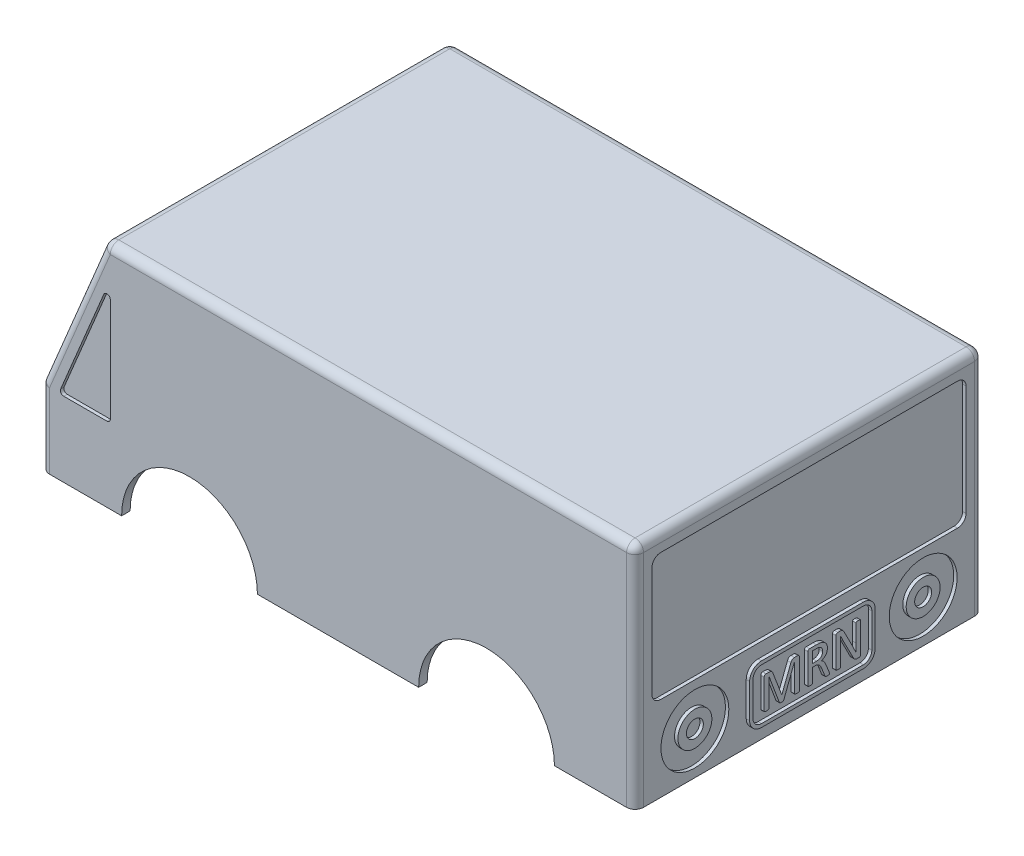
from build123d import *

# Parameters (mm, degrees)
BOSS_EXTRUDE1_DEPTH = 205
FILLET1_R           = 5
SHELL1_START        = 5
SHELL1_DEPTH        = 195
SKETCH4_W           = 183
SKETCH4_H           = 81.166666667
CUT_EXTRUDE1_DEPTH  = 2
FILLET2_R           = 5
CUT_EXTRUDE4_REACH  = 429.493
SKETCH8_R           = 40
CUT_EXTRUDE5_DEPTH  = 205
CUT_EXTRUDE12_DEPTH = 2
CUT_EXTRUDE13_DEPTH = 2
FILLET3_R           = 2
SKETCH13_W          = 185
SKETCH13_H          = 75
CUT_EXTRUDE14_DEPTH = 2
FILLET4_R           = 5
BOSS_EXTRUDE5_DEPTH = 2
BOSS_EXTRUDE6_DEPTH = 2
BOSS_EXTRUDE7_DEPTH = 2
BOSS_EXTRUDE8_DEPTH = 2
CUT_EXTRUDE16_DEPTH = 2
CUT_EXTRUDE17_DEPTH = 2


# Read off the part's stored shape, not the designer's step: Shell1
with BuildPart() as part:
    # Sketch1 → Boss-Extrude1 (new body)
    with BuildSketch(Plane.XY):
        Polygon((0, 0), (350, 0), (350, 135), (37.5, 135), (0, 45), align=None)
    extrude(amount=BOSS_EXTRUDE1_DEPTH)

    # Fillet1
    fillet1_edges = [part.edges().sort_by_distance(p)[0] for p in [
        (350, 67.5, 205),
        (193.75, 135, 205),
        (18.75, 90, 205),
        (0, 22.5, 205),
        (18.75, 90, 0),
        (193.75, 135, 0),
        (350, 67.5, 0),
        (0, 22.5, 0),
        (0, 45, 102.5),
        (37.5, 135, 102.5),
        (350, 135, 102.5),
    ]]
    fillet(fillet1_edges, radius=FILLET1_R)

    # Shell1 outline → Shell1 (cut)
    with BuildSketch(Plane.XY.offset(SHELL1_START)):
        Polygon((5, 44), (5, 0), (345, 0), (345, 130), (40.833333333, 130), align=None)
    extrude(amount=SHELL1_DEPTH, mode=Mode.SUBTRACT)

    # Sketch4 → Cut-Extrude1 (cut)
    with BuildSketch(Plane(origin=(-15.976331361, 6.656804734, 0), x_dir=(0, 0, 1), z_dir=(-0.9230769230769232, 0.38461538461538447, 0))):
        with Locations((102.5, 89.121794872)):
            Rectangle(SKETCH4_W, SKETCH4_H)
    extrude(amount=-CUT_EXTRUDE1_DEPTH, mode=Mode.SUBTRACT)

    # Fillet2
    fillet2_edges = [part.edges().sort_by_distance(p)[0] for p in [
        (3.615384615, 51.076923077, 194),
        (3.615384615, 51.076923077, 11),
        (34.833333333, 126, 11),
        (34.833333333, 126, 194),
    ]]
    fillet(fillet2_edges, radius=FILLET2_R)

    # Cut-Extrude4: up to this face of the body (flat: up to its plane)
    cut_extrude4_end = Plane(part.part.faces().sort_by_distance((180.70890825, 63.687653429, 0))[0])
    # Sketch8 → Cut-Extrude4 (cut, up to the picked face)
    with BuildSketch(Plane.XY.offset(205), mode=Mode.PRIVATE) as cut_extrude4_sk1:
        with Locations((87.5, 0)):
            Circle(SKETCH8_R)
    cut_extrude4_tool1 = split(extrude(cut_extrude4_sk1.sketch, amount=-CUT_EXTRUDE4_REACH, mode=Mode.PRIVATE), bisect_by=cut_extrude4_end, keep=Keep.BOTH, mode=Mode.PRIVATE)
    add(cut_extrude4_tool1.solids().sort_by(Axis((87.5, 0, 205), (0, 0, -1)))[0], mode=Mode.SUBTRACT)

    # Sketch9 → Cut-Extrude5 (cut)
    with BuildSketch(Plane.XY.offset(205)):
        with BuildLine():
            ThreePointArc((222.5, 0), (262.5, -40), (302.5, 0))
            Line((302.5, 0), (262.5, 0))
            Line((262.5, 0), (222.5, 0))
        make_face()
        with BuildLine():
            Line((262.5, 0), (302.5, 0))
            ThreePointArc((302.5, 0), (262.5, 40), (222.5, 0))
            Line((222.5, 0), (262.5, 0))
        make_face()
    extrude(amount=-CUT_EXTRUDE5_DEPTH, mode=Mode.SUBTRACT)

    # Sketch10 → Cut-Extrude12 (cut)
    with BuildSketch(Plane.XY.offset(205)):
        Polygon((40.833333333, 44), (40.833333333, 117), (10.416666667, 44), align=None)
    extrude(amount=-CUT_EXTRUDE12_DEPTH, mode=Mode.SUBTRACT)

    # Sketch12 → Cut-Extrude13 (cut)
    with BuildSketch(Plane(origin=(0, 0, 0), x_dir=(-1, 0, 0), z_dir=(0, 0, -1))):
        Polygon((-10.416666667, 44), (-40.833333333, 117), (-40.833333333, 44), align=None)
    extrude(amount=-CUT_EXTRUDE13_DEPTH, mode=Mode.SUBTRACT)

    # Fillet3
    fillet3_edges = [part.edges().sort_by_distance(p)[0] for p in [
        (40.833333333, 44, 204),
        (10.416666667, 44, 204),
        (40.833333333, 117, 204),
        (40.833333333, 44, 1),
        (40.833333333, 117, 1),
        (10.416666667, 44, 1),
    ]]
    fillet(fillet3_edges, radius=FILLET3_R)

    # Sketch13 → Cut-Extrude14 (cut)
    with BuildSketch(Plane(origin=(350, 0, 0), x_dir=(0, 0, -1), z_dir=(1, 0, 0))):
        with Locations((-102.5, 87.5)):
            Rectangle(SKETCH13_W, SKETCH13_H)
    extrude(amount=-CUT_EXTRUDE14_DEPTH, mode=Mode.SUBTRACT)

    # Fillet4
    fillet4_edges = [part.edges().sort_by_distance(p)[0] for p in [
        (349, 125, 10),
        (349, 50, 10),
        (349, 50, 195),
        (349, 125, 195),
    ]]
    fillet(fillet4_edges, radius=FILLET4_R)

    # Sketch14 → Boss-Extrude5 (add)
    with BuildSketch(Plane.ZY):
        with BuildLine():
            ThreePointArc((132.5, 39), (137.449747468, 36.949747468), (139.5, 32))
            Line((139.5, 32), (139.5, 12))
            ThreePointArc((139.5, 12), (137.449747468, 7.050252532), (132.5, 5))
            Line((132.5, 5), (72.5, 5))
            ThreePointArc((72.5, 5), (67.550252532, 7.050252532), (65.5, 12))
            Line((65.5, 12), (65.5, 32))
            ThreePointArc((65.5, 32), (67.550252532, 36.949747468), (72.5, 39))
            Line((72.5, 39), (132.5, 39))
        make_face()
        with BuildLine():
            ThreePointArc((72.5, 37), (68.964466094, 35.535533906), (67.5, 32))
            Line((67.5, 32), (67.5, 12))
            ThreePointArc((67.5, 12), (68.964466094, 8.464466094), (72.5, 7))
            Line((72.5, 7), (132.5, 7))
            ThreePointArc((132.5, 7), (136.035533906, 8.464466094), (137.5, 12))
            Line((137.5, 12), (137.5, 32))
            ThreePointArc((137.5, 32), (136.035533906, 35.535533906), (132.5, 37))
            Line((132.5, 37), (72.5, 37))
        make_face(mode=Mode.SUBTRACT)
    extrude(amount=BOSS_EXTRUDE5_DEPTH)

    # Sketch18 → Boss-Extrude6 (add)
    # profile 1 of 3: a face of its own
    with BuildSketch(Plane.ZY):
        with BuildLine():
            add(Edge.make_bspline(
                [(94.795955882, 12.468370864), (94.792679632, 12.431253299), (94.786160524, 12.357396483), (94.728957363, 12.254767665), (94.628339062, 12.172260128), (94.482327548, 12.113199979), (94.288785411, 12.075809298), (94.047953126, 12.026816611), (93.739940864, 12.003970812), (93.51341254, 12.001426073), (93.386465993, 12)],
                knots=[0, 0, 0, 0, 0.549940415, 1.094275647, 1.695058239, 2.453752044, 3.41269449, 4.626954335, 6.109744105, 8, 8, 8, 8], degree=3))
            add(Edge.make_bspline(
                [(93.386465993, 12), (93.266828939, 12.001700844), (93.044718685, 12.004858519), (92.739508266, 12.026485618), (92.494502974, 12.075744258), (92.300094584, 12.11198277), (92.15733555, 12.173745719), (92.056160182, 12.25348747), (92.0053255, 12.358680519), (91.998133337, 12.431456894), (91.994485294, 12.468370864)],
                knots=[0, 0, 0, 0, 1.798275377, 3.338559297, 4.58570577, 5.553580443, 6.299307474, 6.905686155, 7.444937074, 8, 8, 8, 8], degree=3))
            Line((91.994485294, 12.468370864), (91.994485294, 28.983915441))
            Line((91.994485294, 28.983915441), (91.96384421, 28.983915441))
            Line((91.96384421, 28.983915441), (85.581744026, 12.393956801))
            add(Edge.make_bspline(
                [(85.581744026, 12.393956801), (85.565528215, 12.362455949), (85.532219438, 12.297750281), (85.455337152, 12.214457182), (85.352241232, 12.138036694), (85.212857313, 12.08644423), (85.041800249, 12.04844666), (84.841447814, 12.017916341), (84.604440608, 12.000937738), (84.434921167, 12.000329776), (84.34296875, 12)],
                knots=[0, 0, 0, 0, 0.617868315, 1.269158706, 1.964077171, 2.846421734, 3.844013633, 5.032644331, 6.390417486, 8, 8, 8, 8], degree=3))
            add(Edge.make_bspline(
                [(84.34296875, 12), (84.246671794, 12.002370625), (84.068497745, 12.006756889), (83.820742866, 12.020673171), (83.614176662, 12.055546439), (83.446004201, 12.101676978), (83.314760298, 12.161319959), (83.209338822, 12.222905064), (83.141711577, 12.306556788), (83.11336895, 12.365683708), (83.099816176, 12.393956801)],
                knots=[0, 0, 0, 0, 1.684713544, 3.117151853, 4.33356902, 5.342914851, 6.153770431, 6.85436779, 7.4521858, 8, 8, 8, 8], degree=3))
            Line((83.099816176, 12.393956801), (76.884053309, 28.983915441))
            Line((76.884053309, 28.983915441), (76.866544118, 28.983915441))
            Line((76.866544118, 28.983915441), (76.866544118, 12.468370864))
            add(Edge.make_bspline(
                [(76.866544118, 12.468370864), (76.863267741, 12.431253841), (76.856748381, 12.357398106), (76.799547159, 12.254760974), (76.698920031, 12.172291292), (76.551622042, 12.112491447), (76.354904653, 12.076120123), (76.108346044, 12.026452909), (75.795903251, 12.004340883), (75.56648331, 12.001546265), (75.439545037, 12)],
                knots=[0, 0, 0, 0, 0.544103173, 1.082660658, 1.677066352, 2.427707141, 3.397415481, 4.619936966, 6.129807882, 8, 8, 8, 8], degree=3))
            add(Edge.make_bspline(
                [(75.439545037, 12), (75.316996128, 12.001627042), (75.093430802, 12.004595246), (74.788122495, 12.026238337), (74.546284445, 12.076436555), (74.354264588, 12.111097396), (74.214384903, 12.173687478), (74.117304372, 12.25392861), (74.071512151, 12.359406944), (74.067248917, 12.43155572), (74.065073529, 12.468370864)],
                knots=[0, 0, 0, 0, 1.8533371, 3.381033053, 4.614072809, 5.587846392, 6.318072483, 6.911573342, 7.444611737, 8, 8, 8, 8], degree=3))
            Line((74.065073529, 12.468370864), (74.065073529, 29.907525276))
            add(Edge.make_bspline(
                [(74.065073529, 29.907525276), (74.068464398, 30.00290607), (74.074820495, 30.18169495), (74.14216518, 30.427042755), (74.245900674, 30.635745412), (74.406753799, 30.787968069), (74.584936811, 30.904515318), (74.776813189, 30.990656634), (74.979055703, 31.038549688), (75.116854843, 31.046186653), (75.185661765, 31.05)],
                knots=[0, 0, 0, 0, 1.261982118, 2.365553467, 3.35280749, 4.310975745, 5.26129003, 6.171318277, 7.086888644, 8, 8, 8, 8], degree=3))
            Line((75.185661765, 31.05), (76.831525735, 31.05))
            add(Edge.make_bspline(
                [(76.831525735, 31.05), (76.990864552, 31.046562562), (77.287765331, 31.04015748), (77.705882484, 30.973854401), (78.071068207, 30.864025303), (78.383630537, 30.692207334), (78.654301837, 30.477740272), (78.86550976, 30.197446766), (79.046956171, 29.874358003), (79.138568081, 29.63464288), (79.186511949, 29.509191176)],
                knots=[0, 0, 0, 0, 1.24751318, 2.324528587, 3.308036964, 4.218670816, 5.104345063, 5.991788597, 6.949029422, 8, 8, 8, 8], degree=3))
            Line((79.186511949, 29.509191176), (84.430514706, 15.781985294))
            Line((84.430514706, 15.781985294), (84.504928768, 15.781985294))
            Line((84.504928768, 15.781985294), (89.836477482, 29.465418199))
            add(Edge.make_bspline(
                [(89.836477482, 29.465418199), (89.895058768, 29.602396137), (90.005335777, 29.860251819), (90.202074156, 30.205955626), (90.417511207, 30.489017882), (90.657779476, 30.70857491), (90.923202498, 30.872468131), (91.220505, 30.976640955), (91.552695597, 31.038612326), (91.786989814, 31.046052119), (91.911316636, 31.05)],
                knots=[0, 0, 0, 0, 1.266394147, 2.383938095, 3.374429421, 4.279357972, 5.137103734, 6.00865411, 6.943304242, 8, 8, 8, 8], degree=3))
            Line((91.911316636, 31.05), (93.640349265, 31.05))
            add(Edge.make_bspline(
                [(93.640349265, 31.05), (93.717937079, 31.046380189), (93.87025882, 31.039273714), (94.089547367, 30.991213142), (94.290771847, 30.910535005), (94.459813169, 30.782392888), (94.605341854, 30.623251183), (94.706837763, 30.419790283), (94.790405639, 30.180796586), (94.794011008, 30.003282924), (94.795955882, 29.907525276)],
                knots=[0, 0, 0, 0, 1.011400516, 1.985599013, 2.915098522, 3.813295393, 4.72984914, 5.700323623, 6.759466748, 8, 8, 8, 8], degree=3))
            Line((94.795955882, 29.907525276), (94.795955882, 12.468370864))
        make_face()
    # profile 2 of 3: a face of its own
    with BuildSketch(Plane.ZY):
        with BuildLine():
            add(Edge.make_bspline(
                [(112.615935202, 12.472748162), (112.614921222, 12.436081799), (112.612960798, 12.365191277), (112.578066836, 12.262261655), (112.496681163, 12.175410478), (112.368136134, 12.105424909), (112.182495814, 12.065176696), (111.942130398, 12.022498488), (111.626819842, 12.00530514), (111.391721486, 12.001914519), (111.258972886, 12)],
                knots=[0, 0, 0, 0, 0.552394781, 1.067996698, 1.59843911, 2.308737636, 3.243716164, 4.449494886, 5.995202554, 8, 8, 8, 8], degree=3))
            add(Edge.make_bspline(
                [(111.258972886, 12), (111.142226092, 12.001819225), (110.931826532, 12.005097808), (110.64755915, 12.024011362), (110.422638986, 12.062374203), (110.244797581, 12.117421057), (110.105585367, 12.198642471), (109.998982997, 12.309047771), (109.926479141, 12.452840499), (109.88775248, 12.556990015), (109.866992188, 12.612821691)],
                knots=[0, 0, 0, 0, 1.682217191, 3.031670033, 4.099618773, 4.963789911, 5.699229685, 6.398004984, 7.141214756, 8, 8, 8, 8], degree=3))
            Line((109.866992188, 12.612821691), (108.111695772, 17.152079504))
            add(Edge.make_bspline(
                [(108.111695772, 17.152079504), (108.010244526, 17.401071199), (107.814446145, 17.881618975), (107.496398293, 18.561796031), (107.15977639, 19.177779872), (106.810777684, 19.614855959), (106.505112522, 19.918351462), (106.2557839, 20.115682367), (105.983985393, 20.282576903), (105.695673794, 20.429061519), (105.379897574, 20.543711059), (105.036675853, 20.627092507), (104.662224645, 20.674154267), (104.402795936, 20.681008675), (104.268428309, 20.684558824)],
                knots=[0, 0, 0, 0, 1.715323276, 3.310531238, 4.791054184, 6.182626586, 6.860777511, 7.536944129, 8.206086956, 8.893127879, 9.597119937, 10.344592274, 11.14260373, 12, 12, 12, 12], degree=3))
            Line((104.268428309, 20.684558824), (102.640073529, 20.684558824))
            Line((102.640073529, 20.684558824), (102.640073529, 12.47712546))
            add(Edge.make_bspline(
                [(102.640073529, 12.47712546), (102.636882748, 12.439946191), (102.630362338, 12.363969798), (102.569493732, 12.260868876), (102.46930591, 12.177443268), (102.326078703, 12.118259482), (102.136751394, 12.073395252), (101.894834059, 12.027286447), (101.588476111, 12.004128585), (101.363383415, 12.001466845), (101.239338235, 12)],
                knots=[0, 0, 0, 0, 0.551870684, 1.127756021, 1.730647335, 2.472085589, 3.418462175, 4.636984023, 6.146692761, 8, 8, 8, 8], degree=3))
            add(Edge.make_bspline(
                [(101.239338235, 12), (101.115332329, 12.001655464), (100.888857816, 12.004678871), (100.58061269, 12.025974866), (100.337242124, 12.076212554), (100.144205302, 12.111945766), (100.001454509, 12.173752726), (99.90027755, 12.253485979), (99.849443216, 12.358680886), (99.842251007, 12.431457018), (99.838602941, 12.468370864)],
                knots=[0, 0, 0, 0, 1.853790896, 3.385616091, 4.604455936, 5.567015365, 6.308647111, 6.911695762, 7.447985294, 8, 8, 8, 8], degree=3))
            Line((99.838602941, 12.468370864), (99.838602941, 30.025712316))
            add(Edge.make_bspline(
                [(99.838602941, 30.025712316), (99.841091832, 30.113642543), (99.845759091, 30.278532559), (99.901759248, 30.503805607), (99.99460977, 30.69068593), (100.172005292, 30.866070041), (100.434267163, 31.013824127), (100.664034711, 31.038194077), (100.775344669, 31.05)],
                knots=[0, 0, 0, 0, 1.007241378, 1.88881631, 2.645546133, 3.368137109, 4.725004673, 6, 6, 6, 6], degree=3))
            Line((100.775344669, 31.05), (104.793704044, 31.05))
            add(Edge.make_bspline(
                [(104.793704044, 31.05), (105.011193811, 31.049627249), (105.40703927, 31.048948818), (105.953968898, 31.0129842), (106.418122901, 30.979214928), (106.703718237, 30.949943242), (106.837902114, 30.936190257)],
                knots=[0, 0, 0, 0, 1.27372654, 2.318264775, 3.209854915, 4, 4, 4, 4], degree=3))
            add(Edge.make_bspline(
                [(106.837902114, 30.936190257), (107.014723605, 30.901170062), (107.361630345, 30.832463811), (107.865113559, 30.707196449), (108.330886231, 30.533837225), (108.771130672, 30.351593127), (109.17302259, 30.128037505), (109.549344961, 29.891784432), (109.882519748, 29.615152947), (110.187573084, 29.318999521), (110.451215681, 28.991885204), (110.696028233, 28.651724254), (110.881948712, 28.275356315), (111.049471667, 27.885988447), (111.168273578, 27.470366556), (111.263038641, 27.036733241), (111.314491379, 26.580559712), (111.321216375, 26.270104568), (111.324632353, 26.112408088)],
                knots=[0, 0, 0, 0, 1.191122015, 2.336866698, 3.42242524, 4.471809322, 5.481243804, 6.457256698, 7.402799425, 8.336721758, 9.26124262, 10.175808252, 11.098517904, 12.027701383, 12.97324411, 13.948876047, 14.958126376, 16, 16, 16, 16], degree=3))
            add(Edge.make_bspline(
                [(111.324632353, 26.112408088), (111.320641055, 25.959117297), (111.312870126, 25.660665026), (111.270664984, 25.224013888), (111.192038791, 24.812471872), (111.080777684, 24.425414781), (110.947800244, 24.060188049), (110.777525894, 23.720983495), (110.586171602, 23.400568117), (110.292535395, 23.002227711), (109.857376832, 22.55234643), (109.246451387, 22.090011591), (108.548641757, 21.705108777), (108.045534992, 21.504972502), (107.787775735, 21.402435662)],
                knots=[0, 0, 0, 0, 0.870093262, 1.69404378, 2.48656215, 3.244089618, 3.9777523, 4.688775412, 5.394571765, 6.09348547, 7.493200162, 8.929089906, 10.426664953, 12, 12, 12, 12], degree=3))
            add(Edge.make_bspline(
                [(107.787775735, 21.402435662), (107.941013732, 21.330143932), (108.244811087, 21.186824151), (108.650546158, 20.881014249), (109.028879315, 20.527879344), (109.372817496, 20.106246309), (109.700765183, 19.625821167), (109.997111025, 19.071773234), (110.299790461, 18.456097071), (110.48105639, 18.014164931), (110.57611443, 17.782410386)],
                knots=[0, 0, 0, 0, 0.864679079, 1.714243352, 2.585566623, 3.507869762, 4.491310941, 5.557114259, 6.718921253, 8, 8, 8, 8], degree=3))
            Line((110.57611443, 17.782410386), (112.292015165, 13.558318015))
            add(Edge.make_bspline(
                [(112.292015165, 13.558318015), (112.322282193, 13.476476927), (112.378492388, 13.324486336), (112.460128233, 13.119814716), (112.510790816, 12.949781946), (112.561598312, 12.789228602), (112.606277779, 12.635740741), (112.613068413, 12.521132228), (112.615935202, 12.472748162)],
                knots=[0, 0, 0, 0, 1.38137286, 2.56540674, 3.485806926, 4.187128033, 5.23466316, 6, 6, 6, 6], degree=3))
        make_face()
        with BuildLine():
            add(Edge.make_bspline(
                [(108.523161765, 25.880411305), (108.5168383, 26.061597434), (108.50468072, 26.409948322), (108.424044363, 26.913753154), (108.272681699, 27.368956426), (108.073071701, 27.786691554), (107.796249569, 28.152641423), (107.441120025, 28.464899754), (107.006946537, 28.720730151), (106.679801982, 28.836263285), (106.509604779, 28.896369485)],
                knots=[0, 0, 0, 0, 1.106837018, 2.128019726, 3.103131596, 4.027783155, 4.943935065, 5.884596147, 6.899459546, 8, 8, 8, 8], degree=3))
            add(Edge.make_bspline(
                [(106.509604779, 28.896369485), (106.389108525, 28.929797184), (106.136450268, 28.999888857), (105.798576372, 29.043095415), (105.497030998, 29.062684931), (105.233250471, 29.084784386), (104.935189046, 29.083564494), (104.725109187, 29.087103041), (104.614234835, 29.088970588)],
                knots=[0, 0, 0, 0, 1.17598894, 2.465830294, 3.195893525, 4.021865782, 4.955995349, 6, 6, 6, 6], degree=3))
            Line((104.614234835, 29.088970588), (102.640073529, 29.088970588))
            Line((102.640073529, 29.088970588), (102.640073529, 22.645588235))
            Line((102.640073529, 22.645588235), (104.929400276, 22.645588235))
            add(Edge.make_bspline(
                [(104.929400276, 22.645588235), (105.078394146, 22.647099193), (105.367023587, 22.650026205), (105.782380742, 22.701006061), (106.167971071, 22.773876337), (106.523685153, 22.877618795), (106.847625525, 23.014996441), (107.145218156, 23.172486775), (107.41249461, 23.357870485), (107.654711261, 23.562993931), (107.867012924, 23.791972756), (108.045339533, 24.044072055), (108.201790075, 24.310069689), (108.35804534, 24.698243661), (108.495309717, 25.222178195), (108.513734517, 25.657615235), (108.523161765, 25.880411305)],
                knots=[0, 0, 0, 0, 1.139982929, 2.208363576, 3.198662771, 4.142437321, 5.038734787, 5.888427894, 6.715795914, 7.524011596, 8.31458568, 9.098978977, 9.884644091, 10.670944343, 12.296652677, 14, 14, 14, 14], degree=3))
        make_face(mode=Mode.SUBTRACT)
    # profile 3 of 3: a face of its own
    with BuildSketch(Plane.ZY):
        with BuildLine():
            add(Edge.make_bspline(
                [(130.934926471, 13.085569853), (130.930845084, 12.994358686), (130.923158162, 12.822570706), (130.840626645, 12.587071553), (130.716007103, 12.395881477), (130.558847234, 12.244071993), (130.375649366, 12.127594716), (130.172148016, 12.052489481), (129.96081479, 12.006967224), (129.818934543, 12.002307424), (129.748678768, 12)],
                knots=[0, 0, 0, 0, 1.205332051, 2.270133854, 3.263058457, 4.207272684, 5.146716114, 6.120602819, 7.069366549, 8, 8, 8, 8], degree=3))
            Line((129.748678768, 12), (128.855710018, 12))
            add(Edge.make_bspline(
                [(128.855710018, 12), (128.722775064, 12.004324328), (128.472813404, 12.012455496), (128.11580925, 12.069459095), (127.794936218, 12.194353939), (127.494696692, 12.38393148), (127.208029359, 12.651497545), (126.920693012, 12.994621804), (126.636055648, 13.428603473), (126.465432268, 13.757889902), (126.373782169, 13.934765625)],
                knots=[0, 0, 0, 0, 0.949232932, 1.784871716, 2.566305995, 3.389914927, 4.304220435, 5.353751779, 6.578571646, 8, 8, 8, 8], degree=3))
            Line((126.373782169, 13.934765625), (120.858386949, 24.72042739))
            add(Edge.make_bspline(
                [(120.858386949, 24.72042739), (120.713733459, 25.006303481), (120.419123588, 25.588535676), (119.978599799, 26.46866675), (119.564708147, 27.362718172), (119.299344231, 27.959306267), (119.16875, 28.25290671)],
                knots=[0, 0, 0, 0, 0.981689664, 1.999367364, 3.015423486, 4, 4, 4, 4], degree=3))
            Line((119.16875, 28.25290671), (119.138108915, 28.25290671))
            add(Edge.make_bspline(
                [(119.138108915, 28.25290671), (119.146381256, 27.898361626), (119.163128673, 27.180582426), (119.17027125, 26.097824705), (119.168370835, 25.00641187), (119.168623781, 24.278320654), (119.16875, 23.915004596)],
                knots=[0, 0, 0, 0, 0.98097619, 1.98599371, 2.995014897, 4, 4, 4, 4], degree=3))
            Line((119.16875, 23.915004596), (119.16875, 12.468370864))
            add(Edge.make_bspline(
                [(119.16875, 12.468370864), (119.165114163, 12.434219116), (119.157575438, 12.363407194), (119.100639347, 12.263278492), (119.002034319, 12.176603414), (118.856130094, 12.112020852), (118.661421854, 12.076307611), (118.419382954, 12.026286613), (118.111231107, 12.004367641), (117.884733903, 12.001557016), (117.75926011, 12)],
                knots=[0, 0, 0, 0, 0.508335614, 1.054008165, 1.670659208, 2.440203295, 3.401501664, 4.618744696, 6.126869023, 8, 8, 8, 8], degree=3))
            add(Edge.make_bspline(
                [(117.75926011, 12), (117.633800007, 12.001569283), (117.407327514, 12.004402051), (117.099027278, 12.026188054), (116.858785971, 12.076285306), (116.667023611, 12.110363374), (116.528488043, 12.179395808), (116.42995742, 12.261872882), (116.379396872, 12.364653792), (116.371247654, 12.434405456), (116.367279412, 12.468370864)],
                knots=[0, 0, 0, 0, 1.889779863, 3.4113088, 4.639371011, 5.587829463, 6.32466679, 6.946798791, 7.487146164, 8, 8, 8, 8], degree=3))
            Line((116.367279412, 12.468370864), (116.367279412, 29.964430147))
            add(Edge.make_bspline(
                [(116.367279412, 29.964430147), (116.370353958, 30.055533735), (116.376165014, 30.227724345), (116.44880855, 30.463014002), (116.557628, 30.663129153), (116.722782657, 30.80628665), (116.90618912, 30.91307267), (117.098709797, 30.994091802), (117.30206765, 31.038317756), (117.43951983, 31.046049361), (117.509754136, 31.05)],
                knots=[0, 0, 0, 0, 1.223169262, 2.311854749, 3.289963268, 4.250317348, 5.211476418, 6.146325302, 7.052822907, 8, 8, 8, 8], degree=3))
            Line((117.509754136, 31.05), (118.844829963, 31.05))
            add(Edge.make_bspline(
                [(118.844829963, 31.05), (118.989562041, 31.047910389), (119.254128913, 31.044090629), (119.620539873, 30.986165073), (119.935983464, 30.891769644), (120.210748448, 30.734466326), (120.467451165, 30.527135366), (120.708245869, 30.252611973), (120.948000853, 29.91247767), (121.083514072, 29.649787636), (121.156043199, 29.509191176)],
                knots=[0, 0, 0, 0, 1.163767092, 2.127339175, 2.97798627, 3.798249142, 4.658572155, 5.623288963, 6.727941249, 8, 8, 8, 8], degree=3))
            Line((121.156043199, 29.509191176), (125.388890165, 21.18794807))
            add(Edge.make_bspline(
                [(125.388890165, 21.18794807), (125.5179478, 20.937314393), (125.772472756, 20.443019529), (126.138704033, 19.703967177), (126.50069664, 18.984630856), (126.838587851, 18.271647154), (127.179458087, 17.576745648), (127.504705367, 16.88447228), (127.843030634, 16.203514349), (128.057067157, 15.744501379), (128.164096967, 15.514970129)],
                knots=[0, 0, 0, 0, 1.0712473, 2.112693089, 3.134304823, 4.131228243, 5.110761677, 6.075495007, 7.037643669, 8, 8, 8, 8], degree=3))
            Line((128.164096967, 15.514970129), (128.17722886, 15.514970129))
            add(Edge.make_bspline(
                [(128.17722886, 15.514970129), (128.169318931, 15.90745734), (128.153176566, 16.708434315), (128.140394003, 17.918078136), (128.138368922, 19.127702103), (128.13507154, 19.928746055), (128.133455882, 20.321243107)],
                knots=[0, 0, 0, 0, 0.980073767, 2.000107263, 3.020088721, 4, 4, 4, 4], degree=3))
            Line((128.133455882, 20.321243107), (128.133455882, 30.581629136))
            add(Edge.make_bspline(
                [(128.133455882, 30.581629136), (128.137193688, 30.615711619), (128.144727146, 30.684404065), (128.197761955, 30.784227733), (128.296929048, 30.868915208), (128.443396559, 30.936988611), (128.636420106, 30.993049733), (128.885557053, 31.023890069), (129.198184369, 31.045800112), (129.430530717, 31.048493758), (129.560454963, 31.05)],
                knots=[0, 0, 0, 0, 0.502306873, 1.012387733, 1.62172544, 2.391521802, 3.378703101, 4.574561681, 6.084551388, 8, 8, 8, 8], degree=3))
            add(Edge.make_bspline(
                [(129.560454963, 31.05), (129.677288307, 31.04842868), (129.895123072, 31.045498968), (130.194029691, 31.022086445), (130.442439954, 30.996967844), (130.629600964, 30.930678023), (130.772929982, 30.865458384), (130.865325019, 30.777025841), (130.923890392, 30.682694066), (130.931345265, 30.614424692), (130.934926471, 30.581629136)],
                knots=[0, 0, 0, 0, 1.782961236, 3.324315921, 4.584666104, 5.571046144, 6.348297572, 6.962920232, 7.501802847, 8, 8, 8, 8], degree=3))
            Line((130.934926471, 30.581629136), (130.934926471, 13.085569853))
        make_face()
    extrude(amount=BOSS_EXTRUDE6_DEPTH)

    # Sketch19 → Boss-Extrude7 (add)
    with BuildSketch(Plane(origin=(350, 0, 0), x_dir=(0, 0, -1), z_dir=(1, 0, 0))):
        with BuildLine():
            Line((-139.5, 35), (-139.5, 15))
            ThreePointArc((-139.5, 15), (-137.449747468, 10.050252532), (-132.5, 8))
            Line((-132.5, 8), (-72.5, 8))
            ThreePointArc((-72.5, 8), (-67.550252532, 10.050252532), (-65.5, 15))
            Line((-65.5, 15), (-65.5, 35))
            ThreePointArc((-65.5, 35), (-67.550252532, 39.949747468), (-72.5, 42))
            Line((-72.5, 42), (-132.5, 42))
            ThreePointArc((-132.5, 42), (-137.449747468, 39.949747468), (-139.5, 35))
        make_face()
        with BuildLine():
            Line((-132.5, 40), (-72.5, 40))
            ThreePointArc((-72.5, 40), (-68.964466094, 38.535533906), (-67.5, 35))
            Line((-67.5, 35), (-67.5, 15))
            ThreePointArc((-67.5, 15), (-68.964466094, 11.464466094), (-72.5, 10))
            Line((-72.5, 10), (-132.5, 10))
            ThreePointArc((-132.5, 10), (-136.035533906, 11.464466094), (-137.5, 15))
            Line((-137.5, 15), (-137.5, 35))
            ThreePointArc((-137.5, 35), (-136.035533906, 38.535533906), (-132.5, 40))
        make_face(mode=Mode.SUBTRACT)
    extrude(amount=BOSS_EXTRUDE7_DEPTH)

    # Sketch20 → Boss-Extrude8 (add)
    # profile 1 of 3: a face of its own
    with BuildSketch(Plane(origin=(350, 0, 0), x_dir=(0, 0, -1), z_dir=(1, 0, 0))):
        with BuildLine():
            add(Edge.make_bspline(
                [(-110.204044118, 15.468370864), (-110.207320368, 15.431253299), (-110.213839476, 15.357396483), (-110.271042637, 15.254767665), (-110.371660938, 15.172260128), (-110.517672452, 15.113199979), (-110.711214589, 15.075809298), (-110.952046874, 15.026816611), (-111.260059136, 15.003970812), (-111.48658746, 15.001426073), (-111.613534007, 15)],
                knots=[0, 0, 0, 0, 0.549940415, 1.094275647, 1.695058239, 2.453752044, 3.41269449, 4.626954335, 6.109744105, 8, 8, 8, 8], degree=3))
            add(Edge.make_bspline(
                [(-111.613534007, 15), (-111.733171061, 15.001700844), (-111.955281315, 15.004858519), (-112.260491734, 15.026485618), (-112.505497026, 15.075744258), (-112.699905416, 15.11198277), (-112.84266445, 15.173745719), (-112.943839818, 15.25348747), (-112.9946745, 15.358680519), (-113.001866663, 15.431456894), (-113.005514706, 15.468370864)],
                knots=[0, 0, 0, 0, 1.798275377, 3.338559297, 4.58570577, 5.553580443, 6.299307474, 6.905686155, 7.444937074, 8, 8, 8, 8], degree=3))
            Line((-113.005514706, 15.468370864), (-113.005514706, 31.983915441))
            Line((-113.005514706, 31.983915441), (-113.03615579, 31.983915441))
            Line((-113.03615579, 31.983915441), (-119.418255974, 15.393956801))
            add(Edge.make_bspline(
                [(-119.418255974, 15.393956801), (-119.434471785, 15.362455949), (-119.467780562, 15.297750281), (-119.544662848, 15.214457182), (-119.647758768, 15.138036694), (-119.787142687, 15.08644423), (-119.958199751, 15.04844666), (-120.158552186, 15.017916341), (-120.395559392, 15.000937738), (-120.565078833, 15.000329776), (-120.65703125, 15)],
                knots=[0, 0, 0, 0, 0.617868315, 1.269158706, 1.964077171, 2.846421734, 3.844013633, 5.032644331, 6.390417486, 8, 8, 8, 8], degree=3))
            add(Edge.make_bspline(
                [(-120.65703125, 15), (-120.753328206, 15.002370625), (-120.931502255, 15.006756889), (-121.179257134, 15.020673171), (-121.385823338, 15.055546439), (-121.553995799, 15.101676978), (-121.685239702, 15.161319959), (-121.790661178, 15.222905064), (-121.858288423, 15.306556788), (-121.88663105, 15.365683708), (-121.900183824, 15.393956801)],
                knots=[0, 0, 0, 0, 1.684713544, 3.117151853, 4.33356902, 5.342914851, 6.153770431, 6.85436779, 7.4521858, 8, 8, 8, 8], degree=3))
            Line((-121.900183824, 15.393956801), (-128.115946691, 31.983915441))
            Line((-128.115946691, 31.983915441), (-128.133455882, 31.983915441))
            Line((-128.133455882, 31.983915441), (-128.133455882, 15.468370864))
            add(Edge.make_bspline(
                [(-128.133455882, 15.468370864), (-128.136732259, 15.431253841), (-128.143251619, 15.357398106), (-128.200452841, 15.254760974), (-128.301079969, 15.172291292), (-128.448377958, 15.112491447), (-128.645095347, 15.076120123), (-128.891653956, 15.026452909), (-129.204096749, 15.004340883), (-129.43351669, 15.001546265), (-129.560454963, 15)],
                knots=[0, 0, 0, 0, 0.544103173, 1.082660658, 1.677066352, 2.427707141, 3.397415481, 4.619936966, 6.129807882, 8, 8, 8, 8], degree=3))
            add(Edge.make_bspline(
                [(-129.560454963, 15), (-129.683003872, 15.001627042), (-129.906569198, 15.004595246), (-130.211877505, 15.026238337), (-130.453715555, 15.076436555), (-130.645735412, 15.111097396), (-130.785615097, 15.173687478), (-130.882695628, 15.25392861), (-130.928487849, 15.359406944), (-130.932751083, 15.43155572), (-130.934926471, 15.468370864)],
                knots=[0, 0, 0, 0, 1.8533371, 3.381033053, 4.614072809, 5.587846392, 6.318072483, 6.911573342, 7.444611737, 8, 8, 8, 8], degree=3))
            Line((-130.934926471, 15.468370864), (-130.934926471, 32.907525276))
            add(Edge.make_bspline(
                [(-130.934926471, 32.907525276), (-130.931535602, 33.00290607), (-130.925179505, 33.18169495), (-130.85783482, 33.427042755), (-130.754099326, 33.635745412), (-130.593246201, 33.787968069), (-130.415063189, 33.904515318), (-130.223186811, 33.990656634), (-130.020944297, 34.038549688), (-129.883145157, 34.046186653), (-129.814338235, 34.05)],
                knots=[0, 0, 0, 0, 1.261982118, 2.365553467, 3.35280749, 4.310975745, 5.26129003, 6.171318277, 7.086888644, 8, 8, 8, 8], degree=3))
            Line((-129.814338235, 34.05), (-128.168474265, 34.05))
            add(Edge.make_bspline(
                [(-128.168474265, 34.05), (-128.009135448, 34.046562562), (-127.712234669, 34.04015748), (-127.294117516, 33.973854401), (-126.928931793, 33.864025303), (-126.616369463, 33.692207334), (-126.345698163, 33.477740272), (-126.13449024, 33.197446766), (-125.953043829, 32.874358003), (-125.861431919, 32.63464288), (-125.813488051, 32.509191176)],
                knots=[0, 0, 0, 0, 1.24751318, 2.324528587, 3.308036964, 4.218670816, 5.104345063, 5.991788597, 6.949029422, 8, 8, 8, 8], degree=3))
            Line((-125.813488051, 32.509191176), (-120.569485294, 18.781985294))
            Line((-120.569485294, 18.781985294), (-120.495071232, 18.781985294))
            Line((-120.495071232, 18.781985294), (-115.163522518, 32.465418199))
            add(Edge.make_bspline(
                [(-115.163522518, 32.465418199), (-115.104941232, 32.602396137), (-114.994664223, 32.860251819), (-114.797925844, 33.205955626), (-114.582488793, 33.489017882), (-114.342220524, 33.70857491), (-114.076797502, 33.872468131), (-113.779495, 33.976640955), (-113.447304403, 34.038612326), (-113.213010186, 34.046052119), (-113.088683364, 34.05)],
                knots=[0, 0, 0, 0, 1.266394147, 2.383938095, 3.374429421, 4.279357972, 5.137103734, 6.00865411, 6.943304242, 8, 8, 8, 8], degree=3))
            Line((-113.088683364, 34.05), (-111.359650735, 34.05))
            add(Edge.make_bspline(
                [(-111.359650735, 34.05), (-111.282062921, 34.046380189), (-111.12974118, 34.039273714), (-110.910452633, 33.991213142), (-110.709228153, 33.910535005), (-110.540186831, 33.782392888), (-110.394658146, 33.623251183), (-110.293162237, 33.419790283), (-110.209594361, 33.180796586), (-110.205988992, 33.003282924), (-110.204044118, 32.907525276)],
                knots=[0, 0, 0, 0, 1.011400516, 1.985599013, 2.915098522, 3.813295393, 4.72984914, 5.700323623, 6.759466748, 8, 8, 8, 8], degree=3))
            Line((-110.204044118, 32.907525276), (-110.204044118, 15.468370864))
        make_face()
    # profile 2 of 3: a face of its own
    with BuildSketch(Plane(origin=(350, 0, 0), x_dir=(0, 0, -1), z_dir=(1, 0, 0))):
        with BuildLine():
            add(Edge.make_bspline(
                [(-92.384064798, 15.472748162), (-92.385078778, 15.436081799), (-92.387039202, 15.365191277), (-92.421933164, 15.262261655), (-92.503318837, 15.175410478), (-92.631863866, 15.105424909), (-92.817504186, 15.065176696), (-93.057869602, 15.022498488), (-93.373180158, 15.00530514), (-93.608278514, 15.001914519), (-93.741027114, 15)],
                knots=[0, 0, 0, 0, 0.552394781, 1.067996698, 1.59843911, 2.308737636, 3.243716164, 4.449494886, 5.995202554, 8, 8, 8, 8], degree=3))
            add(Edge.make_bspline(
                [(-93.741027114, 15), (-93.857773908, 15.001819225), (-94.068173468, 15.005097808), (-94.35244085, 15.024011362), (-94.577361014, 15.062374203), (-94.755202419, 15.117421057), (-94.894414633, 15.198642471), (-95.001017003, 15.309047771), (-95.073520859, 15.452840499), (-95.11224752, 15.556990015), (-95.133007812, 15.612821691)],
                knots=[0, 0, 0, 0, 1.682217191, 3.031670033, 4.099618773, 4.963789911, 5.699229685, 6.398004984, 7.141214756, 8, 8, 8, 8], degree=3))
            Line((-95.133007812, 15.612821691), (-96.888304228, 20.152079504))
            add(Edge.make_bspline(
                [(-96.888304228, 20.152079504), (-96.989755474, 20.401071199), (-97.185553855, 20.881618975), (-97.503601707, 21.561796031), (-97.84022361, 22.177779872), (-98.189222316, 22.614855959), (-98.494887478, 22.918351462), (-98.7442161, 23.115682367), (-99.016014607, 23.282576903), (-99.304326206, 23.429061519), (-99.620102426, 23.543711059), (-99.963324147, 23.627092507), (-100.337775355, 23.674154267), (-100.597204064, 23.681008675), (-100.731571691, 23.684558824)],
                knots=[0, 0, 0, 0, 1.715323276, 3.310531238, 4.791054184, 6.182626586, 6.860777511, 7.536944129, 8.206086956, 8.893127879, 9.597119937, 10.344592274, 11.14260373, 12, 12, 12, 12], degree=3))
            Line((-100.731571691, 23.684558824), (-102.359926471, 23.684558824))
            Line((-102.359926471, 23.684558824), (-102.359926471, 15.47712546))
            add(Edge.make_bspline(
                [(-102.359926471, 15.47712546), (-102.363117252, 15.439946191), (-102.369637662, 15.363969798), (-102.430506268, 15.260868876), (-102.53069409, 15.177443268), (-102.673921297, 15.118259482), (-102.863248606, 15.073395252), (-103.105165941, 15.027286447), (-103.411523889, 15.004128585), (-103.636616585, 15.001466845), (-103.760661765, 15)],
                knots=[0, 0, 0, 0, 0.551870684, 1.127756021, 1.730647335, 2.472085589, 3.418462175, 4.636984023, 6.146692761, 8, 8, 8, 8], degree=3))
            add(Edge.make_bspline(
                [(-103.760661765, 15), (-103.884667671, 15.001655464), (-104.111142184, 15.004678871), (-104.41938731, 15.025974866), (-104.662757876, 15.076212554), (-104.855794698, 15.111945766), (-104.998545491, 15.173752726), (-105.09972245, 15.253485979), (-105.150556784, 15.358680886), (-105.157748993, 15.431457018), (-105.161397059, 15.468370864)],
                knots=[0, 0, 0, 0, 1.853790896, 3.385616091, 4.604455936, 5.567015365, 6.308647111, 6.911695762, 7.447985294, 8, 8, 8, 8], degree=3))
            Line((-105.161397059, 15.468370864), (-105.161397059, 33.025712316))
            add(Edge.make_bspline(
                [(-105.161397059, 33.025712316), (-105.158908168, 33.113642543), (-105.154240909, 33.278532559), (-105.098240752, 33.503805607), (-105.00539023, 33.69068593), (-104.827994708, 33.866070041), (-104.565732837, 34.013824127), (-104.335965289, 34.038194077), (-104.224655331, 34.05)],
                knots=[0, 0, 0, 0, 1.007241378, 1.88881631, 2.645546133, 3.368137109, 4.725004673, 6, 6, 6, 6], degree=3))
            Line((-104.224655331, 34.05), (-100.206295956, 34.05))
            add(Edge.make_bspline(
                [(-100.206295956, 34.05), (-99.988806189, 34.049627249), (-99.59296073, 34.048948818), (-99.046031102, 34.0129842), (-98.581877099, 33.979214928), (-98.296281763, 33.949943242), (-98.162097886, 33.936190257)],
                knots=[0, 0, 0, 0, 1.27372654, 2.318264775, 3.209854915, 4, 4, 4, 4], degree=3))
            add(Edge.make_bspline(
                [(-98.162097886, 33.936190257), (-97.985276395, 33.901170062), (-97.638369655, 33.832463811), (-97.134886441, 33.707196449), (-96.669113769, 33.533837225), (-96.228869328, 33.351593127), (-95.82697741, 33.128037505), (-95.450655039, 32.891784432), (-95.117480252, 32.615152947), (-94.812426916, 32.318999521), (-94.548784319, 31.991885204), (-94.303971767, 31.651724254), (-94.118051288, 31.275356315), (-93.950528333, 30.885988447), (-93.831726422, 30.470366556), (-93.736961359, 30.036733241), (-93.685508621, 29.580559712), (-93.678783625, 29.270104568), (-93.675367647, 29.112408088)],
                knots=[0, 0, 0, 0, 1.191122015, 2.336866698, 3.42242524, 4.471809322, 5.481243804, 6.457256698, 7.402799425, 8.336721758, 9.26124262, 10.175808252, 11.098517904, 12.027701384, 12.97324411, 13.948876047, 14.958126376, 16, 16, 16, 16], degree=3))
            add(Edge.make_bspline(
                [(-93.675367647, 29.112408088), (-93.679358945, 28.959117297), (-93.687129874, 28.660665026), (-93.729335016, 28.224013888), (-93.807961209, 27.812471872), (-93.919222316, 27.425414781), (-94.052199756, 27.060188049), (-94.222474106, 26.720983495), (-94.413828398, 26.400568117), (-94.707464605, 26.002227711), (-95.142623168, 25.55234643), (-95.753548613, 25.090011591), (-96.451358243, 24.705108777), (-96.954465008, 24.504972502), (-97.212224265, 24.402435662)],
                knots=[0, 0, 0, 0, 0.870093262, 1.69404378, 2.48656215, 3.244089618, 3.9777523, 4.688775412, 5.394571765, 6.09348547, 7.493200162, 8.929089906, 10.426664953, 12, 12, 12, 12], degree=3))
            add(Edge.make_bspline(
                [(-97.212224265, 24.402435662), (-97.058986268, 24.330143932), (-96.755188913, 24.186824151), (-96.349453842, 23.881014249), (-95.971120685, 23.527879344), (-95.627182504, 23.106246309), (-95.299234817, 22.625821167), (-95.002888975, 22.071773234), (-94.700209539, 21.456097071), (-94.51894361, 21.014164931), (-94.42388557, 20.782410386)],
                knots=[0, 0, 0, 0, 0.864679079, 1.714243352, 2.585566623, 3.507869762, 4.491310941, 5.557114259, 6.718921253, 8, 8, 8, 8], degree=3))
            Line((-94.42388557, 20.782410386), (-92.707984835, 16.558318015))
            add(Edge.make_bspline(
                [(-92.707984835, 16.558318015), (-92.677717807, 16.476476927), (-92.621507612, 16.324486336), (-92.539871767, 16.119814716), (-92.489209184, 15.949781946), (-92.438401688, 15.789228602), (-92.393722221, 15.635740741), (-92.386931587, 15.521132228), (-92.384064798, 15.472748162)],
                knots=[0, 0, 0, 0, 1.38137286, 2.56540674, 3.485806926, 4.187128033, 5.23466316, 6, 6, 6, 6], degree=3))
        make_face()
        with BuildLine():
            add(Edge.make_bspline(
                [(-96.476838235, 28.880411305), (-96.4831617, 29.061597434), (-96.49531928, 29.409948322), (-96.575955637, 29.913753154), (-96.727318301, 30.368956426), (-96.926928299, 30.786691554), (-97.203750431, 31.152641423), (-97.558879975, 31.464899754), (-97.993053463, 31.720730151), (-98.320198018, 31.836263285), (-98.490395221, 31.896369485)],
                knots=[0, 0, 0, 0, 1.106837018, 2.128019726, 3.103131596, 4.027783155, 4.943935065, 5.884596147, 6.899459546, 8, 8, 8, 8], degree=3))
            add(Edge.make_bspline(
                [(-98.490395221, 31.896369485), (-98.610891475, 31.929797184), (-98.863549732, 31.999888857), (-99.201423628, 32.043095415), (-99.502969002, 32.062684931), (-99.766749529, 32.084784386), (-100.064810954, 32.083564494), (-100.274890813, 32.087103041), (-100.385765165, 32.088970588)],
                knots=[0, 0, 0, 0, 1.17598894, 2.465830294, 3.195893525, 4.021865782, 4.955995349, 6, 6, 6, 6], degree=3))
            Line((-100.385765165, 32.088970588), (-102.359926471, 32.088970588))
            Line((-102.359926471, 32.088970588), (-102.359926471, 25.645588235))
            Line((-102.359926471, 25.645588235), (-100.070599724, 25.645588235))
            add(Edge.make_bspline(
                [(-100.070599724, 25.645588235), (-99.921605854, 25.647099193), (-99.632976413, 25.650026205), (-99.217619258, 25.701006061), (-98.832028929, 25.773876337), (-98.476314847, 25.877618795), (-98.152374475, 26.014996441), (-97.854781844, 26.172486775), (-97.58750539, 26.357870485), (-97.345288739, 26.562993931), (-97.132987076, 26.791972756), (-96.954660467, 27.044072055), (-96.798209925, 27.310069689), (-96.64195466, 27.698243661), (-96.504690283, 28.222178195), (-96.486265483, 28.657615235), (-96.476838235, 28.880411305)],
                knots=[0, 0, 0, 0, 1.139982929, 2.208363576, 3.198662771, 4.142437321, 5.038734787, 5.888427894, 6.715795914, 7.524011596, 8.31458568, 9.098978977, 9.884644091, 10.670944343, 12.296652677, 14, 14, 14, 14], degree=3))
        make_face(mode=Mode.SUBTRACT)
    # profile 3 of 3: a face of its own
    with BuildSketch(Plane(origin=(350, 0, 0), x_dir=(0, 0, -1), z_dir=(1, 0, 0))):
        with BuildLine():
            add(Edge.make_bspline(
                [(-74.065073529, 16.085569853), (-74.069154916, 15.994358686), (-74.076841838, 15.822570706), (-74.159373355, 15.587071553), (-74.283992897, 15.395881477), (-74.441152766, 15.244071993), (-74.624350634, 15.127594716), (-74.827851984, 15.052489481), (-75.03918521, 15.006967224), (-75.181065457, 15.002307424), (-75.251321232, 15)],
                knots=[0, 0, 0, 0, 1.205332051, 2.270133854, 3.263058457, 4.207272684, 5.146716114, 6.120602819, 7.069366549, 8, 8, 8, 8], degree=3))
            Line((-75.251321232, 15), (-76.144289982, 15))
            add(Edge.make_bspline(
                [(-76.144289982, 15), (-76.277224936, 15.004324328), (-76.527186596, 15.012455496), (-76.88419075, 15.069459095), (-77.205063782, 15.194353939), (-77.505303308, 15.38393148), (-77.791970641, 15.651497545), (-78.079306988, 15.994621804), (-78.363944352, 16.428603473), (-78.534567732, 16.757889902), (-78.626217831, 16.934765625)],
                knots=[0, 0, 0, 0, 0.949232932, 1.784871716, 2.566305995, 3.389914927, 4.304220435, 5.353751779, 6.578571646, 8, 8, 8, 8], degree=3))
            Line((-78.626217831, 16.934765625), (-84.141613051, 27.72042739))
            add(Edge.make_bspline(
                [(-84.141613051, 27.72042739), (-84.286266541, 28.006303481), (-84.580876412, 28.588535676), (-85.021400201, 29.46866675), (-85.435291853, 30.362718172), (-85.700655769, 30.959306267), (-85.83125, 31.25290671)],
                knots=[0, 0, 0, 0, 0.981689664, 1.999367364, 3.015423486, 4, 4, 4, 4], degree=3))
            Line((-85.83125, 31.25290671), (-85.861891085, 31.25290671))
            add(Edge.make_bspline(
                [(-85.861891085, 31.25290671), (-85.853618744, 30.898361626), (-85.836871327, 30.180582426), (-85.82972875, 29.097824705), (-85.831629165, 28.00641187), (-85.831376219, 27.278320654), (-85.83125, 26.915004596)],
                knots=[0, 0, 0, 0, 0.98097619, 1.98599371, 2.995014897, 4, 4, 4, 4], degree=3))
            Line((-85.83125, 26.915004596), (-85.83125, 15.468370864))
            add(Edge.make_bspline(
                [(-85.83125, 15.468370864), (-85.834885837, 15.434219116), (-85.842424562, 15.363407194), (-85.899360653, 15.263278492), (-85.997965681, 15.176603414), (-86.143869906, 15.112020852), (-86.338578146, 15.076307611), (-86.580617046, 15.026286613), (-86.888768893, 15.004367641), (-87.115266097, 15.001557016), (-87.24073989, 15)],
                knots=[0, 0, 0, 0, 0.508335614, 1.054008165, 1.670659208, 2.440203295, 3.401501664, 4.618744696, 6.126869023, 8, 8, 8, 8], degree=3))
            add(Edge.make_bspline(
                [(-87.24073989, 15), (-87.366199993, 15.001569283), (-87.592672486, 15.004402051), (-87.900972722, 15.026188054), (-88.141214029, 15.076285306), (-88.332976389, 15.110363374), (-88.471511957, 15.179395808), (-88.57004258, 15.261872882), (-88.620603128, 15.364653792), (-88.628752346, 15.434405456), (-88.632720588, 15.468370864)],
                knots=[0, 0, 0, 0, 1.889779863, 3.4113088, 4.639371011, 5.587829463, 6.32466679, 6.946798791, 7.487146164, 8, 8, 8, 8], degree=3))
            Line((-88.632720588, 15.468370864), (-88.632720588, 32.964430147))
            add(Edge.make_bspline(
                [(-88.632720588, 32.964430147), (-88.629646042, 33.055533735), (-88.623834986, 33.227724345), (-88.55119145, 33.463014002), (-88.442372, 33.663129153), (-88.277217343, 33.80628665), (-88.09381088, 33.91307267), (-87.901290203, 33.994091802), (-87.69793235, 34.038317756), (-87.56048017, 34.046049361), (-87.490245864, 34.05)],
                knots=[0, 0, 0, 0, 1.223169262, 2.311854749, 3.289963268, 4.250317348, 5.211476418, 6.146325302, 7.052822907, 8, 8, 8, 8], degree=3))
            Line((-87.490245864, 34.05), (-86.155170037, 34.05))
            add(Edge.make_bspline(
                [(-86.155170037, 34.05), (-86.010437959, 34.047910389), (-85.745871087, 34.044090629), (-85.379460127, 33.986165073), (-85.064016536, 33.891769644), (-84.789251552, 33.734466326), (-84.532548835, 33.527135366), (-84.291754131, 33.252611973), (-84.051999147, 32.91247767), (-83.916485928, 32.649787636), (-83.843956801, 32.509191176)],
                knots=[0, 0, 0, 0, 1.163767092, 2.127339175, 2.97798627, 3.798249142, 4.658572155, 5.623288963, 6.727941249, 8, 8, 8, 8], degree=3))
            Line((-83.843956801, 32.509191176), (-79.611109835, 24.18794807))
            add(Edge.make_bspline(
                [(-79.611109835, 24.18794807), (-79.4820522, 23.937314393), (-79.227527244, 23.443019529), (-78.861295967, 22.703967177), (-78.49930336, 21.984630856), (-78.161412149, 21.271647154), (-77.820541913, 20.576745648), (-77.495294633, 19.88447228), (-77.156969366, 19.203514349), (-76.942932843, 18.744501379), (-76.835903033, 18.514970129)],
                knots=[0, 0, 0, 0, 1.0712473, 2.112693089, 3.134304823, 4.131228243, 5.110761677, 6.075495007, 7.037643669, 8, 8, 8, 8], degree=3))
            Line((-76.835903033, 18.514970129), (-76.82277114, 18.514970129))
            add(Edge.make_bspline(
                [(-76.82277114, 18.514970129), (-76.830681069, 18.90745734), (-76.846823434, 19.708434315), (-76.859605997, 20.918078136), (-76.861631078, 22.127702103), (-76.86492846, 22.928746055), (-76.866544118, 23.321243107)],
                knots=[0, 0, 0, 0, 0.980073767, 2.000107263, 3.020088721, 4, 4, 4, 4], degree=3))
            Line((-76.866544118, 23.321243107), (-76.866544118, 33.581629136))
            add(Edge.make_bspline(
                [(-76.866544118, 33.581629136), (-76.862806312, 33.615711619), (-76.855272854, 33.684404065), (-76.802238045, 33.784227733), (-76.703070952, 33.868915208), (-76.556603441, 33.936988611), (-76.363579894, 33.993049733), (-76.114442947, 34.023890069), (-75.801815631, 34.045800112), (-75.569469283, 34.048493758), (-75.439545037, 34.05)],
                knots=[0, 0, 0, 0, 0.502306873, 1.012387733, 1.62172544, 2.391521802, 3.378703101, 4.574561681, 6.084551388, 8, 8, 8, 8], degree=3))
            add(Edge.make_bspline(
                [(-75.439545037, 34.05), (-75.322711693, 34.04842868), (-75.104876928, 34.045498968), (-74.805970309, 34.022086445), (-74.557560046, 33.996967844), (-74.370399036, 33.930678023), (-74.227070018, 33.865458384), (-74.134674981, 33.777025841), (-74.076109608, 33.682694066), (-74.068654735, 33.614424692), (-74.065073529, 33.581629136)],
                knots=[0, 0, 0, 0, 1.782961236, 3.324315921, 4.584666104, 5.571046144, 6.348297572, 6.962920232, 7.501802847, 8, 8, 8, 8], degree=3))
            Line((-74.065073529, 33.581629136), (-74.065073529, 16.085569853))
        make_face()
    extrude(amount=BOSS_EXTRUDE8_DEPTH)

    # Sketch21 → Cut-Extrude16 (cut)
    with BuildSketch(Plane(origin=(350, 0, 0), x_dir=(0, 0, -1), z_dir=(1, 0, 0))):
        with BuildLine():
            ThreePointArc((-189.75, 25), (-169.75, 5), (-149.75, 25))
            Line((-149.75, 25), (-159.75, 25))
            ThreePointArc((-159.75, 25), (-169.75, 15), (-179.75, 25))
            Line((-179.75, 25), (-189.75, 25))
        make_face()
        with BuildLine():
            Line((-159.75, 25), (-149.75, 25))
            ThreePointArc((-149.75, 25), (-169.75, 45), (-189.75, 25))
            Line((-189.75, 25), (-179.75, 25))
            ThreePointArc((-179.75, 25), (-169.75, 35), (-159.75, 25))
        make_face()
        with BuildLine():
            ThreePointArc((-174.75, 25), (-169.75, 20), (-164.75, 25))
            Line((-164.75, 25), (-174.75, 25))
        make_face()
        with BuildLine():
            Line((-174.75, 25), (-164.75, 25))
            ThreePointArc((-164.75, 25), (-169.75, 30), (-174.75, 25))
        make_face()
        with BuildLine():
            ThreePointArc((-40.25, 25), (-35.25, 20), (-30.25, 25))
            Line((-30.25, 25), (-40.25, 25))
        make_face()
        with BuildLine():
            Line((-40.25, 25), (-30.25, 25))
            ThreePointArc((-30.25, 25), (-35.25, 30), (-40.25, 25))
        make_face()
        with BuildLine():
            ThreePointArc((-45.25, 25), (-35.25, 35), (-25.25, 25))
            Line((-25.25, 25), (-15.25, 25))
            ThreePointArc((-15.25, 25), (-35.25, 45), (-55.25, 25))
            Line((-55.25, 25), (-45.25, 25))
        make_face()
        with BuildLine():
            Line((-15.25, 25), (-25.25, 25))
            ThreePointArc((-25.25, 25), (-35.25, 15), (-45.25, 25))
            Line((-45.25, 25), (-55.25, 25))
            ThreePointArc((-55.25, 25), (-35.25, 5), (-15.25, 25))
        make_face()
    extrude(amount=-CUT_EXTRUDE16_DEPTH, mode=Mode.SUBTRACT)

    # Sketch22 → Cut-Extrude17 (cut)
    with BuildSketch(Plane.ZY):
        with BuildLine():
            ThreePointArc((17.75, 22), (35.25, 4.5), (52.75, 22))
            Line((52.75, 22), (45.25, 22))
            ThreePointArc((45.25, 22), (35.25, 12), (25.25, 22))
            Line((25.25, 22), (17.75, 22))
        make_face()
        with BuildLine():
            Line((45.25, 22), (52.75, 22))
            ThreePointArc((52.75, 22), (35.25, 39.5), (17.75, 22))
            Line((17.75, 22), (25.25, 22))
            ThreePointArc((25.25, 22), (35.25, 32), (45.25, 22))
        make_face()
        with BuildLine():
            ThreePointArc((30.25, 22), (35.25, 17), (40.25, 22))
            Line((40.25, 22), (30.25, 22))
        make_face()
        with BuildLine():
            Line((30.25, 22), (40.25, 22))
            ThreePointArc((40.25, 22), (35.25, 27), (30.25, 22))
        make_face()
        with BuildLine():
            ThreePointArc((159.75, 22), (169.75, 32), (179.75, 22))
            Line((179.75, 22), (187.25, 22))
            ThreePointArc((187.25, 22), (169.75, 39.5), (152.25, 22))
            Line((152.25, 22), (159.75, 22))
        make_face()
        with BuildLine():
            Line((187.25, 22), (179.75, 22))
            ThreePointArc((179.75, 22), (169.75, 12), (159.75, 22))
            Line((159.75, 22), (152.25, 22))
            ThreePointArc((152.25, 22), (169.75, 4.5), (187.25, 22))
        make_face()
        with BuildLine():
            ThreePointArc((164.75, 22), (169.75, 17), (174.75, 22))
            Line((174.75, 22), (164.75, 22))
        make_face()
        with BuildLine():
            Line((164.75, 22), (174.75, 22))
            ThreePointArc((174.75, 22), (169.75, 27), (164.75, 22))
        make_face()
    extrude(amount=-CUT_EXTRUDE17_DEPTH, mode=Mode.SUBTRACT)


solid = part.part
